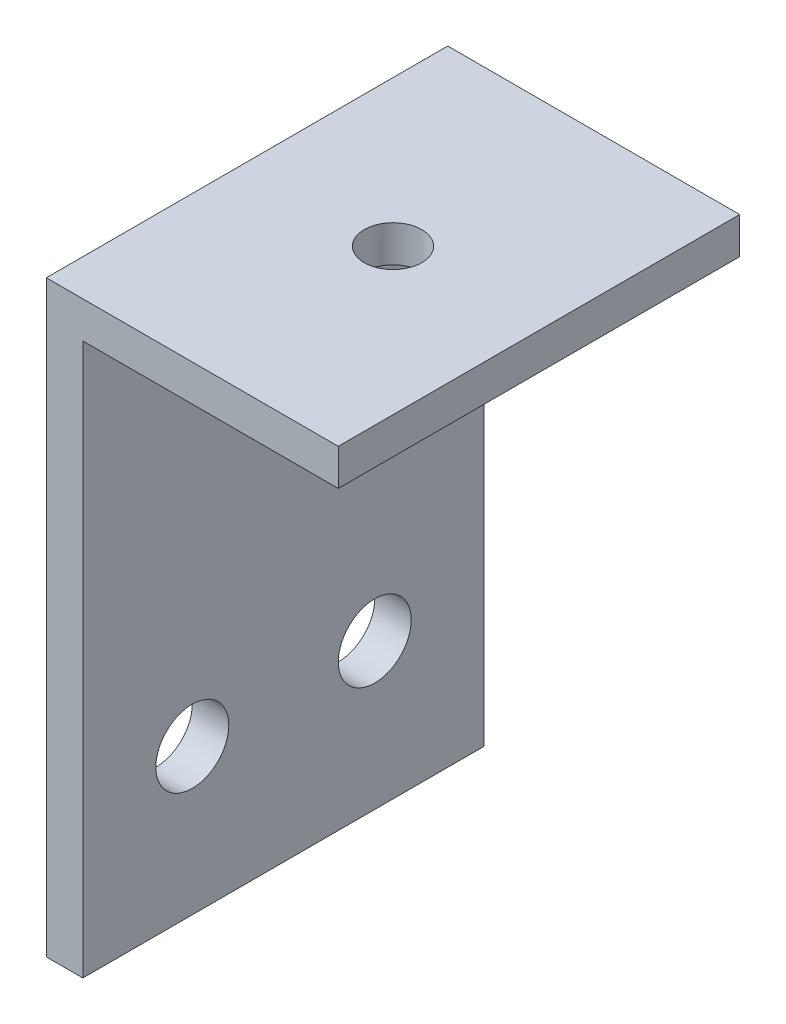
from build123d import *

# Parameters (mm, degrees)
BOSS_EXTRUDE1_DEPTH = 34.925
SKETCH2_R           = 3.175
CUT_EXTRUDE1_DEPTH  = 66.822388858
SKETCH3_R           = 2.5
CUT_EXTRUDE2_DEPTH  = 67.961154784


with BuildPart() as part:
    # Sketch1 → Boss-Extrude1 (new body)
    with BuildSketch(Plane.XY):
        Polygon((0, 0), (3.175, 0), (3.175, 48), (25.4, 48), (25.4, 51.175), (0, 51.175), align=None)
    extrude(amount=BOSS_EXTRUDE1_DEPTH)

    # Sketch2 → Cut-Extrude1 (cut, through all)
    with BuildSketch(Plane(origin=(3.175, 0, 0), x_dir=(0, 0, -1), z_dir=(1, 0, 0))):
        with Locations((-25.4, 12.7)):
            Circle(SKETCH2_R)
        with Locations((-9.525, 12.7)):
            Circle(SKETCH2_R)
    extrude(amount=-CUT_EXTRUDE1_DEPTH, mode=Mode.SUBTRACT)

    # Sketch3 → Cut-Extrude2 (cut, through all)
    with BuildSketch(Plane(origin=(0, 51.175, 0), x_dir=(1, 0, 0), z_dir=(0, 1, 0))):
        with Locations((12.7, -17.4625)):
            Circle(SKETCH3_R)
    extrude(amount=-CUT_EXTRUDE2_DEPTH, mode=Mode.SUBTRACT)


solid = part.part
